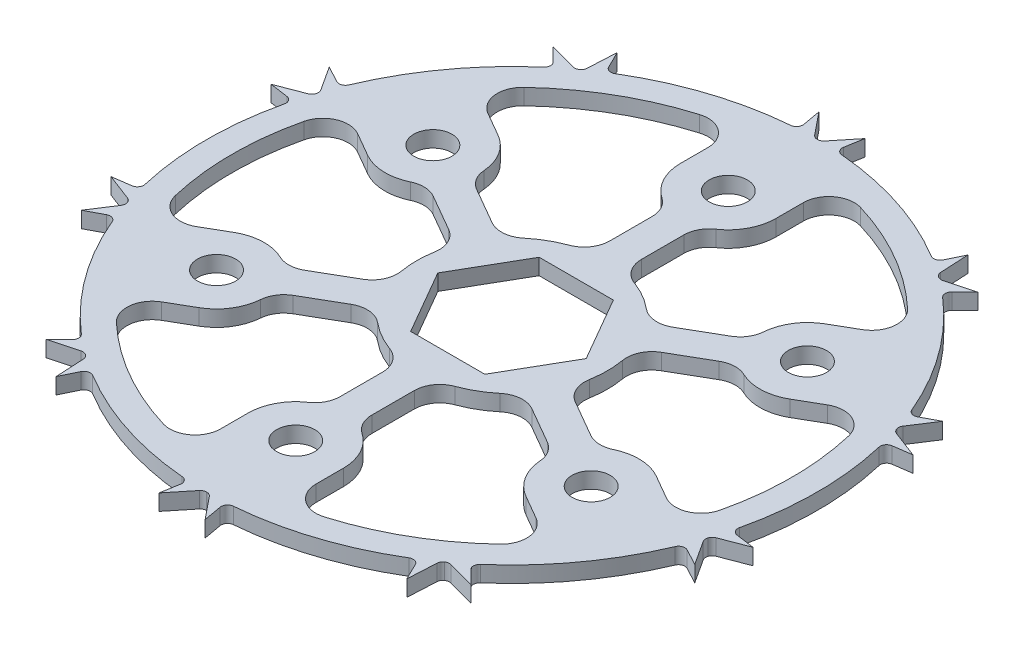
from build123d import *

# Parameters (mm, degrees)
SKETCH1_R                = 31.75
BOSS_EXTRUDE1_DEPTH      = 7.62
CUT_EXTRUDE4_DEPTH       = 0.635
CIRPATTERN2_COUNT        = 20
BOSS_EXTRUDE2_REACH      = 46.031
SKETCH5_R                = 4.7625
SKETCH5_R_2              = 1.397
BOSS_EXTRUDE6_REACH      = 46.031
SKETCH12_R               = 4.7625
SKETCH17_R               = 1.397
CUT_EXTRUDE5_DEPTH       = 43.006102077
CIRPATTERN1_COUNT        = 3
BOSS_EXTRUDE9_REACH      = 40.433
SKETCH18_R               = 12.7
FILLET5_R                = 1.27
CUT_EXTRUDE7_DEPTH       = 39.432836588
SKETCH30_R               = 30.48
SKETCH30_R_2             = 27.94
BOSS_EXTRUDE16_DEPTH     = 1.6002
BOSS_EXTRUDE17_START     = -1.6002
SKETCH31_R               = 1.905
BOSS_EXTRUDE17_DEPTH     = 1.6002
SKETCH33_R               = 9.525
BOSS_EXTRUDE19_DEPTH     = 1.6002
FILLET6_R                = 2.54
FILLET8_R                = 2.54
CIRPATTERN8_COUNT        = 6
FILLET6_OF_CIRPATTERN8_R = 2.54
FILLET8_OF_CIRPATTERN8_R = 2.54
BOSS_EXTRUDE18_DEPTH     = 1.6002
FILLET7_R                = 0.635
CIRPATTERN9_COUNT        = 10
FILLET7_OF_CIRPATTERN9_R = 0.635


with BuildPart() as part:
    # Sketch1 → Boss-Extrude1 (new, symmetric)
    with BuildSketch(Plane(origin=(0, 0, 0), x_dir=(1, 0, 0), z_dir=(0, 1, 0))):
        with Locations(Location((0, 0, 0), (0, 0, 90))):
            Circle(SKETCH1_R)
    extrude(amount=BOSS_EXTRUDE1_DEPTH, both=True)

    # Sketch9 → Cut-Extrude4 (cut)
    with BuildSketch(Plane.ZY.offset(31.75)):
        Polygon((-0.635, -7.62), (0.635, -7.62), (0.635, 0), (0.635, 7.62), (-0.635, 7.62), (-0.635, 0), align=None)
    cut_extrude4 = extrude(amount=-CUT_EXTRUDE4_DEPTH, mode=Mode.SUBTRACT)

    # CirPattern2: Cut-Extrude4 ×20 about axis
    cirpattern2_axis = Axis((0, 0, 0), (0, 1, 0))
    for i in range(1, CIRPATTERN2_COUNT):
        add(cut_extrude4.rotate(cirpattern2_axis, i * 360 / CIRPATTERN2_COUNT), mode=Mode.SUBTRACT)

    # Sketch4 → Cut-Revolve2 (revolve, cut)
    with BuildSketch(Plane.XY, mode=Mode.PRIVATE) as cut_revolve2_sk:
        Polygon((-31.75, -7.62), (-29.21, -7.62), (-29.21, -6.0325), (-6.35, 0), (-29.21, 6.0325), (-29.21, 7.62), (-31.75, 7.62), align=None)
    revolve(cut_revolve2_sk.sketch.rotate(Axis((0, -9.0805, 0), (0, 1, 0)), 270), axis=Axis((0, -9.0805, 0), (0, 1, 0)), mode=Mode.SUBTRACT)

    # Sketch5 → Boss-Extrude2 (add, up to next)
    with BuildSketch(Plane(origin=(0, 7.62, 0), x_dir=(1, 0, 0), z_dir=(0, 1, 0)), mode=Mode.PRIVATE) as boss_extrude2_sk1:
        with Locations(Location((0, 21.59, 0), (0, 0, 270.000000053))):
            Circle(SKETCH5_R)
        with Locations(Location((0, 21.59, 0), (0, 0, 135.973937947))):
            Circle(SKETCH5_R_2, mode=Mode.SUBTRACT)
    boss_extrude2_tool1 = extrude(boss_extrude2_sk1.sketch, amount=-BOSS_EXTRUDE2_REACH, mode=Mode.PRIVATE) - part.part
    boss_extrude2 = boss_extrude2_tool1.solids().sort_by_distance((0, 7.62, -26.217796))[0]
    add(boss_extrude2)

    # Sketch12 → Boss-Extrude6 (add, up to next)
    with BuildSketch(Plane(origin=(0, 7.62, 0), x_dir=(1, 0, 0), z_dir=(0, 1, 0)), mode=Mode.PRIVATE) as boss_extrude6_sk1:
        with Locations(Location((-18.697488468, 10.795, 0), (0, 0, 134.520583051))):
            Circle(SKETCH12_R)
    boss_extrude6_tool1 = extrude(boss_extrude6_sk1.sketch, amount=-BOSS_EXTRUDE6_REACH, mode=Mode.PRIVATE) - part.part
    boss_extrude6 = boss_extrude6_tool1.solids().sort_by_distance((-18.697488, 7.62, -10.795))[0]
    add(boss_extrude6)

    # Sketch17 → Cut-Extrude5 (cut, symmetric)
    with BuildSketch(Plane(origin=(0, 0, 0), x_dir=(1, 0, 0), z_dir=(0, 1, 0))):
        with Locations(Location((0, 21.59, 0), (0, 0, 270))):
            Circle(SKETCH17_R)
        with Locations(Location((-18.697488468, 10.795, 0), (0, 0, 270))):
            Circle(SKETCH17_R)
        with Locations(Location((-18.697488468, -10.795, 0), (0, 0, 270))):
            Circle(SKETCH17_R)
        with BuildLine():
            Line((-22.821934453, -13.17625), (-25.296602045, -14.605))
            ThreePointArc((-25.296602045, -14.605), (-25.296602045, 14.605), (0, 29.21))
            Line((0, 29.21), (0, 26.3525))
            ThreePointArc((0, 26.3525), (-3.367596045, 24.957596045), (-4.7625, 21.59))
            Line((-4.7625, 21.59), (-4.7625, 19.100204678))
            ThreePointArc((-4.7625, 19.100204678), (-9.8425, 17.047710073), (-14.160012469, 13.674548325))
            Line((-14.160012469, 13.674548325), (-16.316238468, 14.919445986))
            ThreePointArc((-16.316238468, 14.919445986), (-22.821934453, 13.17625), (-21.078738468, 6.670554014))
            Line((-21.078738468, 6.670554014), (-18.922512469, 5.425656354))
            ThreePointArc((-18.922512469, 5.425656354), (-19.685, 0), (-18.922512469, -5.425656354))
            Line((-18.922512469, -5.425656354), (-21.078738468, -6.670554014))
            ThreePointArc((-21.078738468, -6.670554014), (-23.297710215, -9.562374298), (-22.821934453, -13.17625))
        make_face()
    cut_extrude5 = extrude(amount=CUT_EXTRUDE5_DEPTH, both=True, mode=Mode.SUBTRACT)

    # CirPattern1: Boss-Extrude2, Boss-Extrude6, Cut-Extrude5 ×3 about axis
    cirpattern1_axis = Axis((0, 0, 0), (0, 1, 0))
    add([boss_extrude2.rotate(cirpattern1_axis, i * 360 / CIRPATTERN1_COUNT) for i in range(1, CIRPATTERN1_COUNT)])
    add([boss_extrude6.rotate(cirpattern1_axis, i * 360 / CIRPATTERN1_COUNT) for i in range(1, CIRPATTERN1_COUNT)])
    add([cut_extrude5.rotate(cirpattern1_axis, i * 360 / CIRPATTERN1_COUNT) for i in range(1, CIRPATTERN1_COUNT)], mode=Mode.SUBTRACT)

    # Sketch18 → Boss-Extrude9 (add, up to next)
    with BuildSketch(Plane.XZ.offset(7.62), mode=Mode.PRIVATE) as boss_extrude9_sk1:
        with Locations(Location((0, 0, 0), (0, 0, 270))):
            Circle(SKETCH18_R)
    boss_extrude9_tool1 = extrude(boss_extrude9_sk1.sketch, amount=-BOSS_EXTRUDE9_REACH, mode=Mode.PRIVATE) - part.part
    add(boss_extrude9_tool1.solids().sort_by_distance((0, -7.62, 0))[0])

    # Fillet5
    fillet5_edges = [part.edges().sort_by_distance(p)[0] for p in [
        (0, 1.675694444, 12.7),
        (0, -1.675694444, 12.7),
    ]]
    fillet(fillet5_edges, radius=FILLET5_R)

    # Sketch24 → Cut-Extrude7 (cut, through all)
    with BuildSketch(Plane.XZ.offset(7.62)):
        Polygon((3.666174209, -6.35), (7.332348419, 0), (3.666174209, 6.35), (-3.666174209, 6.35), (-7.332348419, 0), (-3.666174209, -6.35), align=None)
    extrude(amount=-CUT_EXTRUDE7_DEPTH, mode=Mode.SUBTRACT)


with BuildPart() as body_2:
    # Sketch30 → Boss-Extrude16 (new body)
    with BuildSketch(Plane.XZ.offset(7.62)):
        with Locations(Location((0, 0, 0), (0, 0, 270))):
            Circle(SKETCH30_R)
        with Locations(Location((0, 0, 0), (0, 0, 270))):
            Circle(SKETCH30_R_2, mode=Mode.SUBTRACT)
    extrude(amount=BOSS_EXTRUDE16_DEPTH)

    # Sketch31 → Boss-Extrude17 (add)
    with BuildSketch(Plane.XZ.offset(9.2202).offset(BOSS_EXTRUDE17_START)):
        with BuildLine():
            Line((-4.7625, 21.59), (-4.7625, 30.105630599))
            Line((-4.7625, 30.105630599), (4.7625, 30.105630599))
            Line((4.7625, 30.105630599), (4.7625, 21.59))
            ThreePointArc((4.7625, 21.59), (3.888564967, 18.840369343), (1.5875, 17.099871939))
            Line((1.5875, 17.099871939), (1.5875, 7.62))
            Line((1.5875, 7.62), (-1.5875, 7.62))
            Line((-1.5875, 7.62), (-1.5875, 17.099871939))
            ThreePointArc((-1.5875, 17.099871939), (-3.888564967, 18.840369343), (-4.7625, 21.59))
        make_face()
        with Locations(Location((0, 21.59, 0), (0, 0, 270))):
            Circle(SKETCH31_R, mode=Mode.SUBTRACT)
    boss_extrude17 = extrude(amount=BOSS_EXTRUDE17_DEPTH)

    # Sketch33 → Boss-Extrude19 (add)
    with BuildSketch(Plane.XZ.offset(9.2202)):
        Circle(SKETCH33_R)
        Polygon((3.702835951, -6.4135), (7.405671903, 0), (3.702835951, 6.4135), (-3.702835951, 6.4135), (-7.405671903, 0), (-3.702835951, -6.4135), align=None, mode=Mode.SUBTRACT)
    extrude(amount=-BOSS_EXTRUDE19_DEPTH)

    # Fillet6
    fillet6_edges = [body_2.edges().sort_by_distance(p)[0] for p in [
        (-4.7625, -8.4201, 27.531113195),
        (4.7625, -8.4201, 27.531113195),
    ]]
    fillet(fillet6_edges, radius=FILLET6_R)

    # Fillet8
    fillet8_edges = [body_2.edges().sort_by_distance(p)[0] for p in [
        (-1.5875, -8.4201, 17.099871939),
        (1.5875, -8.4201, 17.099871939),
        (1.5875, -8.4201, 9.391776656),
        (-1.5875, -8.4201, 9.391776656),
    ]]
    fillet(fillet8_edges, radius=FILLET8_R)

    # CirPattern8: Boss-Extrude17 ×6 about axis
    cirpattern8_axis = Axis((0, 0, 0), (0, 1, 0))
    for i in range(1, CIRPATTERN8_COUNT):
        add(boss_extrude17.rotate(cirpattern8_axis, i * 360 / CIRPATTERN8_COUNT))

    # Fillet6 of CirPattern8
    fillet6_of_cirpattern8_edges = [body_2.edges().sort_by_distance(p)[0] for p in [
        (21.461393421, -8.4201, 17.890002583),
        (26.223893421, -8.4201, 9.641110612),
        (26.223893421, -8.4201, -9.641110612),
        (21.461393421, -8.4201, -17.890002583),
        (4.7625, -8.4201, -27.531113195),
        (-4.7625, -8.4201, -27.531113195),
        (-21.461393421, -8.4201, -17.890002583),
        (-26.223893421, -8.4201, -9.641110612),
        (-26.223893421, -8.4201, 9.641110612),
        (-21.461393421, -8.4201, 17.890002583),
    ]]
    fillet(fillet6_of_cirpattern8_edges, radius=FILLET6_OF_CIRPATTERN8_R)

    # Fillet8 of CirPattern8
    fillet8_of_cirpattern8_edges = [body_2.edges().sort_by_distance(p)[0] for p in [
        (14.015173501, -8.4201, 9.924751298),
        (15.602673501, -8.4201, 7.175120641),
        (8.92726717, -8.4201, 3.321072999),
        (7.33976717, -8.4201, 6.070703656),
        (15.602673501, -8.4201, -7.175120641),
        (14.015173501, -8.4201, -9.924751298),
        (7.33976717, -8.4201, -6.070703656),
        (8.92726717, -8.4201, -3.321072999),
        (1.5875, -8.4201, -17.099871939),
        (-1.5875, -8.4201, -17.099871939),
        (-1.5875, -8.4201, -9.391776656),
        (1.5875, -8.4201, -9.391776656),
        (-14.015173501, -8.4201, -9.924751298),
        (-15.602673501, -8.4201, -7.175120641),
        (-8.92726717, -8.4201, -3.321072999),
        (-7.33976717, -8.4201, -6.070703656),
        (-15.602673501, -8.4201, 7.175120641),
        (-14.015173501, -8.4201, 9.924751298),
        (-7.33976717, -8.4201, 6.070703656),
        (-8.92726717, -8.4201, 3.321072999),
    ]]
    fillet(fillet8_of_cirpattern8_edges, radius=FILLET8_OF_CIRPATTERN8_R)

    # Sketch32 → Boss-Extrude18 (add)
    with BuildSketch(Plane.XZ.offset(9.2202)):
        Polygon((2.303358763, 32.93956494), (0.310362745, 30.478419824), (1.859658547, 30.423215972), align=None)
        Polygon((-1.859658547, 30.423215972), (-2.303358763, 32.93956494), (-0.310362745, 30.478419824), align=None)
    boss_extrude18 = extrude(amount=-BOSS_EXTRUDE18_DEPTH)

    # Fillet7
    fillet7_edges = [body_2.edges().sort_by_distance(p)[0] for p in [
        (-0.310362745, -8.4201, 30.478419824),
        (-1.859658547, -8.4201, 30.423215972),
        (1.859658547, -8.4201, 30.423215972),
        (0.310362745, -8.4201, 30.478419824),
    ]]
    fillet(fillet7_edges, radius=FILLET7_R)

    # CirPattern9: Boss-Extrude18 ×10 about axis
    cirpattern9_axis = Axis((0, 0, 0), (0, 1, 0))
    for i in range(1, CIRPATTERN9_COUNT):
        add(boss_extrude18.rotate(cirpattern9_axis, i * 360 / CIRPATTERN9_COUNT))

    # Fillet7 of CirPattern9
    fillet7_of_cirpattern9_edges = [body_2.edges().sort_by_distance(p)[0] for p in [
        (17.663676951, -8.4201, 24.839986244),
        (16.377822307, -8.4201, 25.705978613),
        (19.386813044, -8.4201, 23.519818877),
        (18.165854421, -8.4201, 24.475132955),
        (28.890792417, -8.4201, 9.713522198),
        (28.359531702, -8.4201, 11.169931138),
        (29.508863892, -8.4201, 7.63265038),
        (29.082607143, -8.4201, 9.123177176),
        (29.082607143, -8.4201, -9.123177176),
        (29.508863892, -8.4201, -7.63265038),
        (28.359531702, -8.4201, -11.169931138),
        (28.890792417, -8.4201, -9.713522198),
        (18.165854421, -8.4201, -24.475132955),
        (19.386813044, -8.4201, -23.519818877),
        (16.377822307, -8.4201, -25.705978613),
        (17.663676951, -8.4201, -24.839986244),
        (0.310362745, -8.4201, -30.478419824),
        (1.859658547, -8.4201, -30.423215972),
        (-1.859658547, -8.4201, -30.423215972),
        (-0.310362745, -8.4201, -30.478419824),
        (-17.663676951, -8.4201, -24.839986244),
        (-16.377822307, -8.4201, -25.705978613),
        (-19.386813044, -8.4201, -23.519818877),
        (-18.165854421, -8.4201, -24.475132955),
        (-28.890792417, -8.4201, -9.713522198),
        (-28.359531702, -8.4201, -11.169931138),
        (-29.508863892, -8.4201, -7.63265038),
        (-29.082607143, -8.4201, -9.123177176),
        (-29.082607143, -8.4201, 9.123177176),
        (-29.508863892, -8.4201, 7.63265038),
        (-28.359531702, -8.4201, 11.169931138),
        (-28.890792417, -8.4201, 9.713522198),
        (-18.165854421, -8.4201, 24.475132955),
        (-19.386813044, -8.4201, 23.519818877),
        (-16.377822307, -8.4201, 25.705978613),
        (-17.663676951, -8.4201, 24.839986244),
    ]]
    fillet(fillet7_of_cirpattern9_edges, radius=FILLET7_OF_CIRPATTERN9_R)


solid = body_2.part
